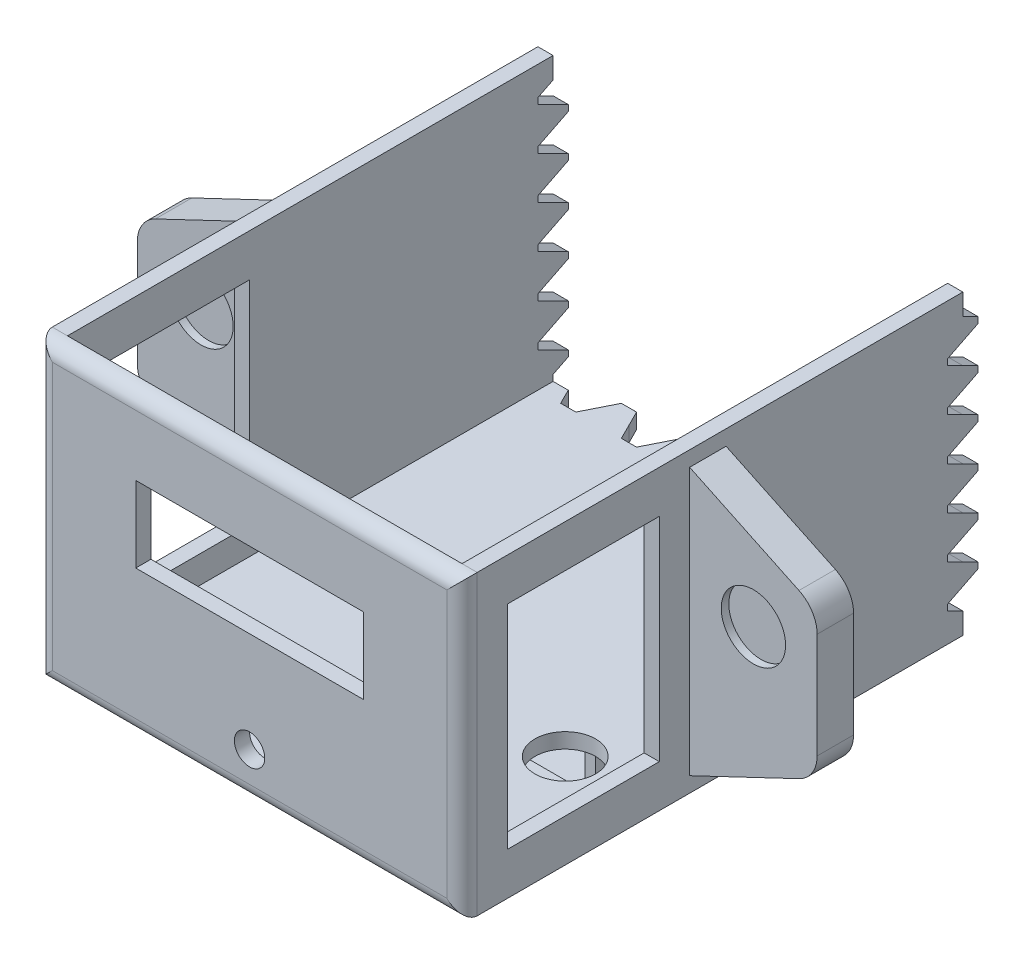
from build123d import *
from OCP.BRepFilletAPI import BRepFilletAPI_MakeChamfer

# Parameters (mm, degrees)
SKETCH1_W                  = 140
SKETCH1_H                  = 98
BOSS_EXTRUDE1_DEPTH        = 170
FACE_FILLET_R              = 5
INTERIOR_START             = -5
INTERIOR_SKETCH_W          = 130
INTERIOR_SKETCH_H          = 93
INTERIOR_CUT_DEPTH         = 199.045897155
DISPLAY_SKETCH_W           = 75
DISPLAY_SKETCH_H           = 25
DISPLAY_CUT_DEPTH          = 5
WINDOW_CUT_REACH           = 231.478
WINDOW_SKETCH_W            = 50
WINDOW_SKETCH_H            = 70
TEETH_START                = -5
TEETH_CUT_1_DEPTH          = 5
TEETH_CUT_2_DEPTH          = 5
TEETH_CUT_BOT_DEPTH        = 5
WIRE_HOLE_SKETCH_R         = 5
WIRE_HOLE_CUT_DEPTH        = 5
SERVO_START                = -5
MOUNT_SKETCH_1_W           = 12
MOUNT_SKETCH_1_H           = 88
SERVO_MOUNT_1_DEPTH        = 42
MOUNT_SKETCH_2_W           = 12
MOUNT_SKETCH_2_H           = 88
SERVO_MOUNT_2_DEPTH        = 42
INDENT_SKETCH_1_R          = 10.6
SERVO_INDENT_1_DEPTH       = 2.5
INDENT_SKETCH_2_R          = 10.6
SERVO_INDENT_2_DEPTH       = 2.5
SERVO_MOUNT_CHAMFER_SIZE   = 42
SERVO_MOUNT_CHAMFER_SIZE_2 = 20
SERVO_MOUNT_FILLET_R       = 10.5
BELLY_SKETCH_W             = 3.5
BELLY_SKETCH_H             = 4.224137931
BELLY_SUPPORTS_DEPTH       = 31
BELLY_START                = 31
SKETCH2_4_W                = 3.5
SKETCH2_4_H                = 4.224137931
BELLY_PLATE_DEPTH          = 4
BELLY_CUT_SKETCH_W         = 51
BELLY_CUT_SKETCH_H         = 65.775862069
BELLY_CUT_DEPTH            = 2
WIRE_HOLE_2_SKETCH_R       = 10
WIRE_HOLE_2_CUT_DEPTH      = 5


# Read off the part's stored shape, not the designer's step: Teeth Cut 1, Teeth Cut 2, Teeth Cut Bot
with BuildPart() as part:
    # Sketch1 → Boss-Extrude1 (new body)
    with BuildSketch(Plane.XY):
        with Locations((-20.374701232, -15.49844749)):
            Rectangle(SKETCH1_W, SKETCH1_H)
    extrude(amount=-BOSS_EXTRUDE1_DEPTH)

    # Face Fillet
    face_fillet_edges = [part.edges().sort_by_distance(p)[0] for p in [
        (-20.374701232, 33.50155251, 0),
        (49.625298768, -15.49844749, 0),
        (-20.374701232, -64.49844749, 0),
        (-90.374701232, -15.49844749, 0),
    ]]
    fillet(face_fillet_edges, radius=FACE_FILLET_R)

    # Interior Sketch → Interior Cut (cut, through all)
    with BuildSketch(Plane.XY.offset(INTERIOR_START)):
        with Locations((-20.374701232, -12.99844749)):
            Rectangle(INTERIOR_SKETCH_W, INTERIOR_SKETCH_H)
    extrude(amount=-INTERIOR_CUT_DEPTH, mode=Mode.SUBTRACT)

    # Display Sketch → Display Cut (cut)
    with BuildSketch(Plane.XY):
        with Locations((-20.374701232, -3.99844749)):
            Rectangle(DISPLAY_SKETCH_W, DISPLAY_SKETCH_H)
    extrude(amount=-DISPLAY_CUT_DEPTH, mode=Mode.SUBTRACT)

    # Window Cut: up to this face of the body (flat: up to its plane)
    window_cut_end = Plane(part.part.faces().sort_by_distance((-90.374701232, -15.49844749, -87.5))[0])
    # Window Sketch → Window Cut (cut, up to the picked face)
    with BuildSketch(Plane(origin=(49.625298768, 0, 0), x_dir=(0, 0, -1), z_dir=(1, 0, 0)), mode=Mode.PRIVATE) as window_cut_sk1:
        with Locations((40, -15.49844749)):
            Rectangle(WINDOW_SKETCH_W, WINDOW_SKETCH_H)
    window_cut_tool1 = split(extrude(window_cut_sk1.sketch, amount=-WINDOW_CUT_REACH, mode=Mode.PRIVATE), bisect_by=window_cut_end, keep=Keep.BOTH, mode=Mode.PRIVATE)
    add(window_cut_tool1.solids().sort_by(Axis((49.625299, -15.498447, -40), (-1, 0, 0)))[0], mode=Mode.SUBTRACT)

    # Teeth Cut 1 outline → Teeth Cut 1 (cut)
    with BuildSketch(Plane(origin=(49.625298768, 0, 0), x_dir=(0, 0, -1), z_dir=(1, 0, 0)).offset(TEETH_START)):
        Polygon((170, 22.00155251), (160, 17.00155251), (160, 15.00155251), (170, 10.00155251), align=None)
        Polygon((165, 26.50155251), (170, 24.00155251), (170, 33.50155251), (165, 33.50155251), align=None)
        Polygon((170, -64.49844749), (170, -47.99844749), (160, -52.99844749), (160, -54.99844749), (165, -57.49844749), (165, -64.49844749), align=None)
        Polygon((170, -45.99844749), (170, -33.99844749), (160, -38.99844749), (160, -40.99844749), align=None)
        Polygon((170, -31.99844749), (170, -19.99844749), (160, -24.99844749), (160, -26.99844749), align=None)
        Polygon((170, -17.99844749), (170, -5.99844749), (160, -10.99844749), (160, -12.99844749), align=None)
        Polygon((170, -3.99844749), (170, 8.00155251), (160, 3.00155251), (160, 1.00155251), align=None)
    extrude(amount=TEETH_CUT_1_DEPTH, mode=Mode.SUBTRACT)

    # Teeth Cut 2 outline → Teeth Cut 2 (cut)
    with BuildSketch(Plane.ZY.offset(90.374701232).offset(TEETH_START)):
        Polygon((-170, -52.99844749), (-160, -47.99844749), (-160, -45.99844749), (-170, -40.99844749), align=None)
        Polygon((-165, -57.49844749), (-170, -54.99844749), (-170, -64.49844749), (-165, -64.49844749), align=None)
        Polygon((-170, 33.50155251), (-170, 17.00155251), (-160, 22.00155251), (-160, 24.00155251), (-165, 26.50155251), (-165, 33.50155251), align=None)
        Polygon((-170, 15.00155251), (-170, 3.00155251), (-160, 8.00155251), (-160, 10.00155251), align=None)
        Polygon((-170, 1.00155251), (-170, -10.99844749), (-160, -5.99844749), (-160, -3.99844749), align=None)
        Polygon((-170, -12.99844749), (-170, -24.99844749), (-160, -19.99844749), (-160, -17.99844749), align=None)
        Polygon((-170, -26.99844749), (-170, -38.99844749), (-160, -33.99844749), (-160, -31.99844749), align=None)
    extrude(amount=TEETH_CUT_2_DEPTH, mode=Mode.SUBTRACT)

    # Teeth Cut Bot outline → Teeth Cut Bot (cut)
    with BuildSketch(Plane.XZ.offset(64.49844749).offset(TEETH_START)):
        Polygon((-67.874701232, -170), (-72.874701232, -160), (-77.874701232, -160), (-80.374701232, -165), (-85.374701232, -165), (-85.374701232, -170), align=None)
        Polygon((39.625298768, -165), (37.125298768, -170), (44.625298768, -170), (44.625298768, -165), align=None)
        Polygon((22.125298768, -160), (17.125298768, -170), (32.125298768, -170), (27.125298768, -160), align=None)
        Polygon((2.125298768, -160), (-2.874701232, -170), (12.125298768, -170), (7.125298768, -160), align=None)
        Polygon((-17.874701232, -160), (-22.874701232, -170), (-7.874701232, -170), (-12.874701232, -160), align=None)
        Polygon((-37.874701232, -160), (-42.874701232, -170), (-27.874701232, -170), (-32.874701232, -160), align=None)
        Polygon((-57.874701232, -160), (-62.874701232, -170), (-47.874701232, -170), (-52.874701232, -160), align=None)
    extrude(amount=TEETH_CUT_BOT_DEPTH, mode=Mode.SUBTRACT)

    # Wire Hole Sketch → Wire Hole Cut (cut)
    with BuildSketch(Plane.XY):
        with Locations((-20.374701232, -49.49844749)):
            Circle(WIRE_HOLE_SKETCH_R)
    extrude(amount=-WIRE_HOLE_CUT_DEPTH, mode=Mode.SUBTRACT)

    # Mount Sketch 1 → Servo Mount 1 (add)
    with BuildSketch(Plane.ZY.offset(-44.625298768).offset(SERVO_START)):
        with Locations((-81, -15.49844749)):
            Rectangle(MOUNT_SKETCH_1_W, MOUNT_SKETCH_1_H)
    extrude(amount=-SERVO_MOUNT_1_DEPTH)

    # Mount Sketch 2 → Servo Mount 2 (add)
    with BuildSketch(Plane(origin=(-85.374701232, 0, 0), x_dir=(0, 0, -1), z_dir=(1, 0, 0)).offset(SERVO_START)):
        with Locations((81, -15.49844749)):
            Rectangle(MOUNT_SKETCH_2_W, MOUNT_SKETCH_2_H)
    extrude(amount=-SERVO_MOUNT_2_DEPTH)

    # Indent Sketch 1 → Servo Indent 1 (cut)
    with BuildSketch(Plane.XY.offset(-75)):
        with Locations((70.625298768, -6.49844749)):
            Circle(INDENT_SKETCH_1_R)
    extrude(amount=-SERVO_INDENT_1_DEPTH, mode=Mode.SUBTRACT)

    # Indent Sketch 2 → Servo Indent 2 (cut)
    with BuildSketch(Plane.XY.offset(-75)):
        with Locations((-111.374701232, -6.49844749)):
            Circle(INDENT_SKETCH_2_R)
    extrude(amount=-SERVO_INDENT_2_DEPTH, mode=Mode.SUBTRACT)

    # Servo Mount Chamfer
    servo_mount_chamfer_edges_1 = [part.edges().sort_by_distance(p)[0] for p in [
        (-132.374701232, -59.49844749, -81),
    ]]
    servo_mount_chamfer_side_1 = [part.faces().sort_by_distance(p)[0] for p in [
        (-131.974701232, -59.49844749, -81),
    ]]
    servo_mount_chamfer_edges_2 = [part.edges().sort_by_distance(p)[0] for p in [
        (91.625298768, -59.49844749, -81),
    ]]
    servo_mount_chamfer_side_2 = [part.faces().sort_by_distance(p)[0] for p in [
        (91.225298768, -59.49844749, -81),
    ]]
    servo_mount_chamfer_edges_3 = [part.edges().sort_by_distance(p)[0] for p in [
        (91.625298768, 28.50155251, -81),
    ]]
    servo_mount_chamfer_side_3 = [part.faces().sort_by_distance(p)[0] for p in [
        (91.225298768, 28.50155251, -81),
    ]]
    servo_mount_chamfer_edges_4 = [part.edges().sort_by_distance(p)[0] for p in [
        (-132.374701232, 28.50155251, -81),
    ]]
    servo_mount_chamfer_side_4 = [part.faces().sort_by_distance(p)[0] for p in [
        (-131.974701232, 28.50155251, -81),
    ]]
    servo_mount_chamfer = BRepFilletAPI_MakeChamfer(part.part.solid().wrapped)
    for e in servo_mount_chamfer_edges_1:
        servo_mount_chamfer.Add(SERVO_MOUNT_CHAMFER_SIZE - 0.0001, SERVO_MOUNT_CHAMFER_SIZE_2 - 0.0001, e.wrapped, servo_mount_chamfer_side_1[0].wrapped)
    for e in servo_mount_chamfer_edges_2:
        servo_mount_chamfer.Add(SERVO_MOUNT_CHAMFER_SIZE - 0.0001, SERVO_MOUNT_CHAMFER_SIZE_2 - 0.0001, e.wrapped, servo_mount_chamfer_side_2[0].wrapped)
    for e in servo_mount_chamfer_edges_3:
        servo_mount_chamfer.Add(SERVO_MOUNT_CHAMFER_SIZE - 0.0001, SERVO_MOUNT_CHAMFER_SIZE_2 - 0.0001, e.wrapped, servo_mount_chamfer_side_3[0].wrapped)
    for e in servo_mount_chamfer_edges_4:
        servo_mount_chamfer.Add(SERVO_MOUNT_CHAMFER_SIZE - 0.0001, SERVO_MOUNT_CHAMFER_SIZE_2 - 0.0001, e.wrapped, servo_mount_chamfer_side_4[0].wrapped)
    add(Compound.cast(servo_mount_chamfer.Shape()), mode=Mode.REPLACE)  # a hair under: the kernel refuses the full size

    # Servo Mount Fillet
    servo_mount_fillet_edges = [part.edges().sort_by_distance(p)[0] for p in [
        (91.625298768, -39.49854749, -81),
        (91.625298768, 8.50165251, -81),
        (-132.374701232, -39.49854749, -81),
        (-132.374701232, 8.50165251, -81),
    ]]
    fillet(servo_mount_fillet_edges, radius=SERVO_MOUNT_FILLET_R)

    # Belly Sketch → Belly Supports (add)
    with BuildSketch(Plane.XZ.offset(64.49844749)):
        with Locations((-47.624701232, -87.112068966)):
            Rectangle(BELLY_SKETCH_W, BELLY_SKETCH_H)
        with Locations((6.875298768, -87.112068966)):
            Rectangle(BELLY_SKETCH_W, BELLY_SKETCH_H)
        with Locations((-47.624701232, -152.887931035)):
            Rectangle(BELLY_SKETCH_W, BELLY_SKETCH_H)
        with Locations((6.875298768, -152.887931035)):
            Rectangle(BELLY_SKETCH_W, BELLY_SKETCH_H)
    extrude(amount=BELLY_SUPPORTS_DEPTH)

    # Sketch2<4> → Belly Plate (add)
    with BuildSketch(Plane.XZ.offset(64.49844749).offset(BELLY_START)):
        Polygon((5.125298768, -85), (-45.874701232, -85), (-45.874701232, -89.224137931), (-49.374701232, -89.224137931), (-49.374701232, -150.775862069), (-45.874701232, -150.775862069), (-45.874701232, -155), (5.125298768, -155), (5.125298768, -150.775862069), (8.625298768, -150.775862069), (8.625298768, -89.224137931), (5.125298768, -89.224137931), align=None)
        with Locations((-47.624701232, -87.112068966)):
            Rectangle(SKETCH2_4_W, SKETCH2_4_H)
        with Locations((6.875298768, -87.112068966)):
            Rectangle(SKETCH2_4_W, SKETCH2_4_H)
        with Locations((6.875298768, -152.887931035)):
            Rectangle(SKETCH2_4_W, SKETCH2_4_H)
        with Locations((-47.624701232, -152.887931035)):
            Rectangle(SKETCH2_4_W, SKETCH2_4_H)
    extrude(amount=BELLY_PLATE_DEPTH)

    # Belly Cut Sketch → Belly Cut (cut)
    with BuildSketch(Plane(origin=(0, -95.49844749, 0), x_dir=(1, 0, 0), z_dir=(0, 1, 0))):
        with Locations((-20.374701232, 122.112068966)):
            Rectangle(BELLY_CUT_SKETCH_W, BELLY_CUT_SKETCH_H)
    extrude(amount=-BELLY_CUT_DEPTH, mode=Mode.SUBTRACT)

    # Wire Hole 2 Sketch → Wire Hole 2 Cut (cut)
    with BuildSketch(Plane.XZ.offset(64.49844749)):
        with Locations(Location((23.625298768, -60, 0), (0, 0, 270))):
            Circle(WIRE_HOLE_2_SKETCH_R)
    extrude(amount=-WIRE_HOLE_2_CUT_DEPTH, mode=Mode.SUBTRACT)


solid = part.part
